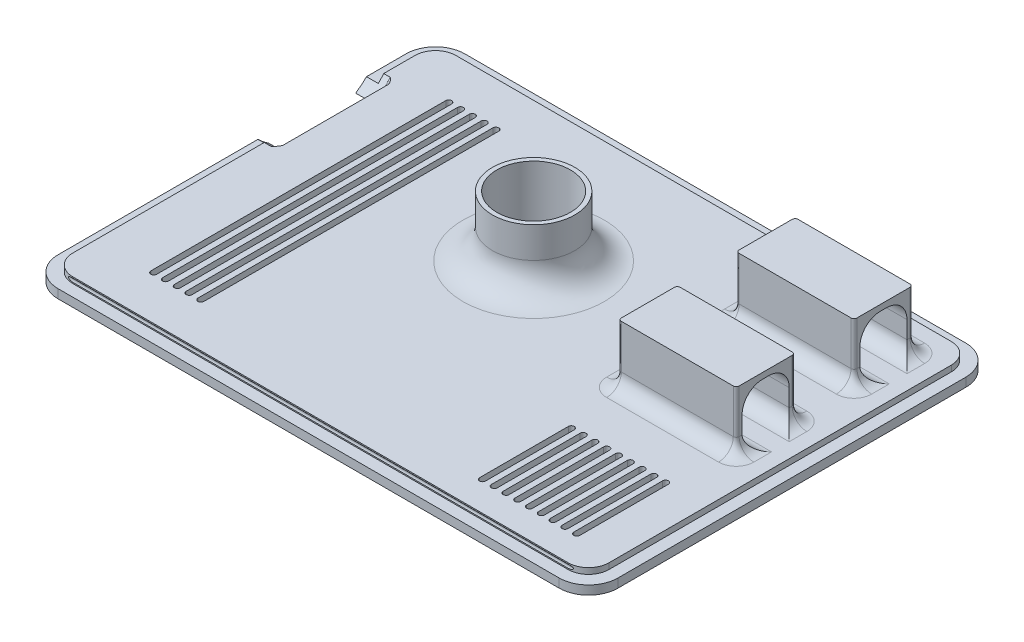
from build123d import *

# Parameters (mm, degrees)
SKETCH1_W                = 190.15
SKETCH1_H                = 138.15
LID_DEPTH                = 3
SKETCH2_W                = 182.15
SKETCH2_H                = 130.15
INSERT_DEPTH             = 2
SKETCH3_W                = 40
SKETCH3_H                = 20
BATTERY_CONTACTS_DEPTH   = 19.9
CONTACT_LIGHTENERS_REACH = 192.841
VENT_HOLES_DEPTH         = 120.191531788
FILLET1_R                = 10
FILLET2_R                = 6.95
SNAP_GROOVE_DEPTH        = 201.107941184
SKETCH6_R                = 14
SKETCH6_R_2              = 12.5
COOLING_GUIDE_DEPTH      = 20.5
FILLET5_R                = 10
SKETCH8_R                = 26.4
EDOF_INSERT_DEPTH        = 8
FILLET6_SIZE             = 1.8
FILLET7_R                = 1
FILLET8_R                = 5


with BuildPart() as part:
    # Sketch1 → Lid (new body)
    with BuildSketch(Plane(origin=(0, 0, 0), x_dir=(1, 0, 0), z_dir=(0, 1, 0))):
        Rectangle(SKETCH1_W, SKETCH1_H)
    extrude(amount=LID_DEPTH)

    # Sketch2 → Insert (add)
    with BuildSketch(Plane(origin=(0, 3, 0), x_dir=(1, 0, 0), z_dir=(0, 1, 0))):
        Rectangle(SKETCH2_W, SKETCH2_H)
    extrude(amount=INSERT_DEPTH)

    # Sketch3 → Battery Contacts (add)
    with BuildSketch(Plane(origin=(0, 5, 0), x_dir=(1, 0, 0), z_dir=(0, 1, 0))):
        with Locations((61.075, 45.075)):
            Rectangle(SKETCH3_W, SKETCH3_H)
        with Locations((61.075, 5.075)):
            Rectangle(SKETCH3_W, SKETCH3_H)
    extrude(amount=BATTERY_CONTACTS_DEPTH)

    # Sketch9 → Contact Lighteners (cut, up to next)
    with BuildSketch(Plane(origin=(81.075, 0, 0), x_dir=(0, 0, -1), z_dir=(1, 0, 0)), mode=Mode.PRIVATE) as contact_lighteners_sk1:
        with BuildLine():
            Line((-2.925, 15.9), (-2.925, 5))
            Line((-2.925, 5), (13.075, 5))
            Line((13.075, 5), (13.075, 15.9))
            ThreePointArc((13.075, 15.9), (11.024747468, 20.849747468), (6.075, 22.9))
            Line((6.075, 22.9), (4.075, 22.9))
            ThreePointArc((4.075, 22.9), (-0.874747468, 20.849747468), (-2.925, 15.9))
        make_face()
    contact_lighteners_tool1 = extrude(contact_lighteners_sk1.sketch, amount=-CONTACT_LIGHTENERS_REACH, mode=Mode.PRIVATE) & part.part
    # Sketch9 → Contact Lighteners (cut, up to next)
    with BuildSketch(Plane(origin=(81.075, 0, 0), x_dir=(0, 0, -1), z_dir=(1, 0, 0)), mode=Mode.PRIVATE) as contact_lighteners_sk2:
        with BuildLine():
            Line((46.075, 22.9), (44.075, 22.9))
            ThreePointArc((44.075, 22.9), (39.125252532, 20.849747468), (37.075, 15.9))
            Line((37.075, 15.9), (37.075, 5))
            Line((37.075, 5), (53.075, 5))
            Line((53.075, 5), (53.075, 15.9))
            ThreePointArc((53.075, 15.9), (51.024747468, 20.849747468), (46.075, 22.9))
        make_face()
    contact_lighteners_tool2 = extrude(contact_lighteners_sk2.sketch, amount=-CONTACT_LIGHTENERS_REACH, mode=Mode.PRIVATE) & part.part
    add(contact_lighteners_tool1.solids().sort_by_distance((81.075, 13.364612, -5.075))[0], mode=Mode.SUBTRACT)
    add(contact_lighteners_tool2.solids().sort_by_distance((81.075, 13.364612, -45.075))[0], mode=Mode.SUBTRACT)

    # Sketch4 → Vent Holes (cut, through all)
    with BuildSketch(Plane(origin=(0, 5, 0), x_dir=(1, 0, 0), z_dir=(0, 1, 0))):
        with BuildLine():
            Line((-21.775, 14.483835008), (-21.775, 21.266164992))
            ThreePointArc((-21.775, 21.266164992), (-22.275, 17.875), (-21.775, 14.483835008))
        make_face()
        with BuildLine():
            Line((-18.775, 9.508399735), (-18.775, 26.241600265))
            ThreePointArc((-18.775, 26.241600265), (-19.570345021, 25.374615553), (-20.275, 24.432438524))
            Line((-20.275, 24.432438524), (-20.275, 11.317561476))
            ThreePointArc((-20.275, 11.317561476), (-19.570345021, 10.375384447), (-18.775, 9.508399735))
        make_face()
        with BuildLine():
            Line((-15.775, 7.363101979), (-15.775, 28.386898021))
            ThreePointArc((-15.775, 28.386898021), (-16.541635363, 27.967700279), (-17.275, 27.492692031))
            Line((-17.275, 27.492692031), (-17.275, 8.257307969))
            ThreePointArc((-17.275, 8.257307969), (-16.541635363, 7.782299721), (-15.775, 7.363101979))
        make_face()
        with BuildLine():
            ThreePointArc((-12.775, 28.875), (-12.823105564, 29.139280534), (-12.961251201, 29.369658763))
            ThreePointArc((-12.961251201, 29.369658763), (-13.616629518, 29.2109749), (-14.261825722, 29.014956621))
            ThreePointArc((-14.261825722, 29.014956621), (-14.271699167, 28.945287654), (-14.275, 28.875))
            Line((-14.275, 28.875), (-14.275, 6.875))
            ThreePointArc((-14.275, 6.875), (-14.271699167, 6.804712346), (-14.261825722, 6.735043379))
            ThreePointArc((-14.261825722, 6.735043379), (-13.616629518, 6.5390251), (-12.961251201, 6.380341237))
            ThreePointArc((-12.961251201, 6.380341237), (-12.823105564, 6.610719466), (-12.775, 6.875))
            Line((-12.775, 6.875), (-12.775, 28.875))
        make_face()
        with BuildLine():
            ThreePointArc((-11.275, 6.875), (-10.525, 6.125), (-9.775, 6.875))
            Line((-9.775, 6.875), (-9.775, 28.875))
            ThreePointArc((-9.775, 28.875), (-10.525, 29.625), (-11.275, 28.875))
            Line((-11.275, 28.875), (-11.275, 6.875))
        make_face()
        with BuildLine():
            ThreePointArc((-6.788174278, 29.014956621), (-7.433370482, 29.2109749), (-8.088748799, 29.369658763))
            ThreePointArc((-8.088748799, 29.369658763), (-8.226894436, 29.139280534), (-8.275, 28.875))
            Line((-8.275, 28.875), (-8.275, 6.875))
            ThreePointArc((-8.275, 6.875), (-8.226894436, 6.610719466), (-8.088748799, 6.380341237))
            ThreePointArc((-8.088748799, 6.380341237), (-7.433370482, 6.5390251), (-6.788174278, 6.735043379))
            ThreePointArc((-6.788174278, 6.735043379), (-6.778300833, 6.804712346), (-6.775, 6.875))
            Line((-6.775, 6.875), (-6.775, 28.875))
            ThreePointArc((-6.775, 28.875), (-6.778300833, 28.945287654), (-6.788174278, 29.014956621))
        make_face()
        with BuildLine():
            ThreePointArc((-3.775, 27.492692031), (-4.508364637, 27.967700279), (-5.275, 28.386898021))
            Line((-5.275, 28.386898021), (-5.275, 7.363101979))
            ThreePointArc((-5.275, 7.363101979), (-4.508364637, 7.782299721), (-3.775, 8.257307969))
            Line((-3.775, 8.257307969), (-3.775, 27.492692031))
        make_face()
        with BuildLine():
            ThreePointArc((-0.775, 24.432438524), (-1.479654979, 25.374615553), (-2.275, 26.241600265))
            Line((-2.275, 26.241600265), (-2.275, 9.508399735))
            ThreePointArc((-2.275, 9.508399735), (-1.479654979, 10.375384447), (-0.775, 11.317561476))
            Line((-0.775, 11.317561476), (-0.775, 24.432438524))
        make_face()
        with BuildLine():
            ThreePointArc((1.225, 17.875), (1.099327938, 19.58891365), (0.725, 21.266164992))
            Line((0.725, 21.266164992), (0.725, 14.483835008))
            ThreePointArc((0.725, 14.483835008), (1.099327938, 16.16108635), (1.225, 17.875))
        make_face()
        with BuildLine():
            Line((46.075, -24.925), (46.075, -55.075))
            ThreePointArc((46.075, -55.075), (45.075, -56.075), (44.075, -55.075))
            Line((44.075, -55.075), (44.075, -24.925))
            ThreePointArc((44.075, -24.925), (45.075, -23.925), (46.075, -24.925))
        make_face()
        with BuildLine():
            Line((50.075, -24.925), (50.075, -55.075))
            ThreePointArc((50.075, -55.075), (49.075, -56.075), (48.075, -55.075))
            Line((48.075, -55.075), (48.075, -24.925))
            ThreePointArc((48.075, -24.925), (49.075, -23.925), (50.075, -24.925))
        make_face()
        with BuildLine():
            Line((54.075, -24.925), (54.075, -55.075))
            ThreePointArc((54.075, -55.075), (53.075, -56.075), (52.075, -55.075))
            Line((52.075, -55.075), (52.075, -24.925))
            ThreePointArc((52.075, -24.925), (53.075, -23.925), (54.075, -24.925))
        make_face()
        with BuildLine():
            Line((58.075, -24.925), (58.075, -55.075))
            ThreePointArc((58.075, -55.075), (57.075, -56.075), (56.075, -55.075))
            Line((56.075, -55.075), (56.075, -24.925))
            ThreePointArc((56.075, -24.925), (57.075, -23.925), (58.075, -24.925))
        make_face()
        with BuildLine():
            Line((60.075, -24.925), (60.075, -55.075))
            ThreePointArc((60.075, -55.075), (61.075, -56.075), (62.075, -55.075))
            Line((62.075, -55.075), (62.075, -24.925))
            ThreePointArc((62.075, -24.925), (61.075, -23.925), (60.075, -24.925))
        make_face()
        with BuildLine():
            Line((66.075, -24.925), (66.075, -55.075))
            ThreePointArc((66.075, -55.075), (65.075, -56.075), (64.075, -55.075))
            Line((64.075, -55.075), (64.075, -24.925))
            ThreePointArc((64.075, -24.925), (65.075, -23.925), (66.075, -24.925))
        make_face()
        with BuildLine():
            Line((70.075, -24.925), (70.075, -55.075))
            ThreePointArc((70.075, -55.075), (69.075, -56.075), (68.075, -55.075))
            Line((68.075, -55.075), (68.075, -24.925))
            ThreePointArc((68.075, -24.925), (69.075, -23.925), (70.075, -24.925))
        make_face()
        with BuildLine():
            Line((74.075, -24.925), (74.075, -55.075))
            ThreePointArc((74.075, -55.075), (73.075, -56.075), (72.075, -55.075))
            Line((72.075, -55.075), (72.075, -24.925))
            ThreePointArc((72.075, -24.925), (73.075, -23.925), (74.075, -24.925))
        make_face()
        with BuildLine():
            Line((78.075, -24.925), (78.075, -55.075))
            ThreePointArc((78.075, -55.075), (77.075, -56.075), (76.075, -55.075))
            Line((76.075, -55.075), (76.075, -24.925))
            ThreePointArc((76.075, -24.925), (77.075, -23.925), (78.075, -24.925))
        make_face()
        with BuildLine():
            Line((-70.575, 50.075), (-70.575, -50.075))
            ThreePointArc((-70.575, -50.075), (-71.575, -51.075), (-72.575, -50.075))
            Line((-72.575, -50.075), (-72.575, 50.075))
            ThreePointArc((-72.575, 50.075), (-71.575, 51.075), (-70.575, 50.075))
        make_face()
        with BuildLine():
            Line((-66.575, 50.075), (-66.575, -50.075))
            ThreePointArc((-66.575, -50.075), (-67.575, -51.075), (-68.575, -50.075))
            Line((-68.575, -50.075), (-68.575, 50.075))
            ThreePointArc((-68.575, 50.075), (-67.575, 51.075), (-66.575, 50.075))
        make_face()
        with BuildLine():
            Line((-62.575, 50.075), (-62.575, -50.075))
            ThreePointArc((-62.575, -50.075), (-63.575, -51.075), (-64.575, -50.075))
            Line((-64.575, -50.075), (-64.575, 50.075))
            ThreePointArc((-64.575, 50.075), (-63.575, 51.075), (-62.575, 50.075))
        make_face()
        with BuildLine():
            Line((-58.575, 50.075), (-58.575, -50.075))
            ThreePointArc((-58.575, -50.075), (-59.575, -51.075), (-60.575, -50.075))
            Line((-60.575, -50.075), (-60.575, 50.075))
            ThreePointArc((-60.575, 50.075), (-59.575, 51.075), (-58.575, 50.075))
        make_face()
        with BuildLine():
            Line((-54.575, 50.075), (-54.575, -50.075))
            ThreePointArc((-54.575, -50.075), (-55.575, -51.075), (-56.575, -50.075))
            Line((-56.575, -50.075), (-56.575, 50.075))
            ThreePointArc((-56.575, 50.075), (-55.575, 51.075), (-54.575, 50.075))
        make_face()
    extrude(amount=-VENT_HOLES_DEPTH, mode=Mode.SUBTRACT)

    # Fillet1
    fillet1_edges = [part.edges().sort_by_distance(p)[0] for p in [
        (-95.075, 1.5, -69.075),
        (95.075, 1.5, -69.075),
        (95.075, 1.5, 69.075),
        (-95.075, 1.5, 69.075),
    ]]
    fillet(fillet1_edges, radius=FILLET1_R)

    # Fillet2
    fillet2_edges = [part.edges().sort_by_distance(p)[0] for p in [
        (91.075, 4, -65.075),
        (-91.075, 4, -65.075),
        (-91.075, 4, 65.075),
        (91.075, 4, 65.075),
    ]]
    fillet(fillet2_edges, radius=FILLET2_R)

    # Sketch5 → Snap Groove (cut, through all)
    with BuildSketch(Plane(origin=(91.075, 0, 0), x_dir=(0, 0, -1), z_dir=(1, 0, 0))):
        with BuildLine():
            Line((-65.075, 4.6), (-65.075, 3.4))
            ThreePointArc((-65.075, 3.4), (-64.875, 4), (-65.075, 4.6))
        make_face()
        with BuildLine():
            Line((65.075, 4.6), (65.075, 3.4))
            ThreePointArc((65.075, 3.4), (64.875, 4), (65.075, 4.6))
        make_face()
    extrude(amount=-SNAP_GROOVE_DEPTH, mode=Mode.SUBTRACT)

    # Sketch6 → Cooling Guide (add)
    with BuildSketch(Plane(origin=(0, 5, 0), x_dir=(1, 0, 0), z_dir=(0, 1, 0))):
        with Locations(Location((-10.525, 17.875, 0), (0, 0, 270))):
            Circle(SKETCH6_R)
        with Locations(Location((-10.525, 17.875, 0), (0, 0, 270))):
            Circle(SKETCH6_R_2, mode=Mode.SUBTRACT)
    extrude(amount=COOLING_GUIDE_DEPTH)

    # Fillet5
    fillet5_edges = [part.edges().sort_by_distance(p)[0] for p in [
        (-10.525, 5, -31.875),
    ]]
    fillet(fillet5_edges, radius=FILLET5_R)

    # Sketch8 → EDoF Insert (cut)
    with BuildSketch(Plane.ZY.offset(95.075)):
        with Locations((-27.225, 21.9)):
            Circle(SKETCH8_R)
    extrude(amount=-EDOF_INSERT_DEPTH, mode=Mode.SUBTRACT)

    # Fillet6
    # a fillet whose section is not a circle: 1.8 mm, written as the material it adds along each edge
    with BuildSketch(Plane(origin=(-87.075, 21.9, -27.225), x_dir=(0, -0.5005540832814384, -0.8657052672302964), z_dir=(0, 0.8657052672302964, -0.5005540832814384))) as fillet6_piece_1_section:
        with BuildLine():
            Bezier((26.4 - FILLET6_SIZE, 0), (26.4, 0), (26.4, FILLET6_SIZE), weights=[1, 0.181827458, 1])
            Line((26.4, FILLET6_SIZE), (26.4, 0))
            Line((26.4, 0), (26.4 - FILLET6_SIZE, 0))
        make_face()
    fillet6_piece_1 = revolve(axis=Axis((-87.075, 21.9, -27.225), (-1, 0, 0)), revolution_arc=35.781862743, mode=Mode.PRIVATE)
    fillet6_piece_1 = split(fillet6_piece_1, bisect_by=Plane(origin=(-87.075, 5, -27.225), z_dir=(0, -1, 0)), keep=Keep.TOP, mode=Mode.PRIVATE)
    fillet6_piece_1 = split(fillet6_piece_1, bisect_by=Plane(origin=(-87.075, 0, -27.225), z_dir=(0, 1, 0)), keep=Keep.TOP, mode=Mode.PRIVATE)
    add(fillet6_piece_1)
    with BuildSketch(Plane(origin=(-87.075, 21.9, -27.225), x_dir=(0, -0.9122526226957021, 0.4096280659144501), z_dir=(0, -0.4096280659144501, -0.9122526226957021))) as fillet6_piece_2_section:
        with BuildLine():
            Bezier((26.4, FILLET6_SIZE), (26.4, 0), (26.4 - FILLET6_SIZE, 0), weights=[1, 0.181827458, 1])
            Line((26.4 - FILLET6_SIZE, 0), (26.4, 0))
            Line((26.4, 0), (26.4, FILLET6_SIZE))
        make_face()
    fillet6_piece_2 = revolve(axis=Axis((-87.075, 21.9, -27.225), (-1, 0, 0)), revolution_arc=35.781862743, mode=Mode.PRIVATE)
    fillet6_piece_2 = split(fillet6_piece_2, bisect_by=Plane(origin=(-87.075, 5, -27.225), z_dir=(0, -1, 0)), keep=Keep.TOP, mode=Mode.PRIVATE)
    fillet6_piece_2 = split(fillet6_piece_2, bisect_by=Plane(origin=(-87.075, 0, -27.225), z_dir=(0, 1, 0)), keep=Keep.TOP, mode=Mode.PRIVATE)
    add(fillet6_piece_2)

    # Fillet7
    fillet7_edges = [part.edges().sort_by_distance(p)[0] for p in [
        (81.075, 14.95, -55.075),
        (41.075, 14.95, -55.075),
        (41.075, 14.95, -35.075),
        (81.075, 14.95, -35.075),
        (41.075, 14.95, 4.925),
        (81.075, 14.95, 4.925),
        (81.075, 14.95, -15.075),
        (41.075, 14.95, -15.075),
    ]]
    fillet(fillet7_edges, radius=FILLET7_R)

    # Fillet8
    fillet8_edges = [part.edges().sort_by_distance(p)[0] for p in [
        (41.075, 5, 3.425),
        (81.075, 5, 3.425),
        (81.075, 5, -53.575),
        (61.075, 5, -55.075),
        (81.075, 5, -36.575),
        (61.075, 5, -35.075),
        (41.075, 5, -53.575),
        (41.075, 5, -36.575),
        (41.075, 5, -13.575),
        (61.075, 5, -15.075),
        (61.075, 5, 4.925),
        (81.075, 5, -13.575),
        (80.782106781, 5, -54.782106781),
        (80.782106781, 5, -35.367893219),
        (41.367893219, 5, -35.367893219),
        (41.367893219, 5, -54.782106781),
        (41.367893219, 5, -14.782106781),
        (41.367893219, 5, 4.632106781),
        (80.782106781, 5, 4.632106781),
        (80.782106781, 5, -14.782106781),
        (61.075, 5, -13.075),
        (61.075, 5, 2.925),
        (61.075, 5, -53.075),
        (61.075, 5, -37.075),
    ]]
    fillet(fillet8_edges, radius=FILLET8_R)


solid = part.part
